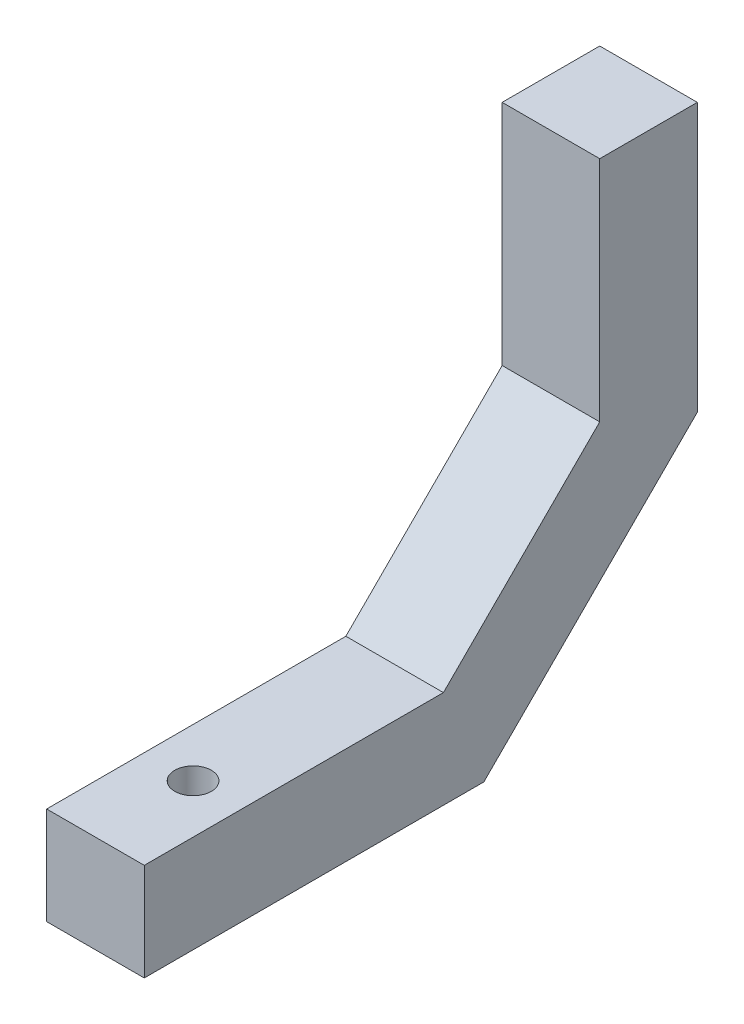
from build123d import *

# Parameters (mm, degrees)
BOSS_EXTRUDE1_DEPTH      = 4
BOSS_EXTRUDE1_DEPTH_BACK = 4
SKETCH3_R                = 1.5
CUT_EXTRUDE1_DEPTH       = 56.353099281


with BuildPart() as part:
    # Sketch1 → Boss-Extrude1 (new, two sides: drawn at the far end of the back side and taken through both)
    with BuildSketch(Plane(origin=(0, 0, 0), x_dir=(0, 0, -1), z_dir=(1, 0, 0)).offset(-BOSS_EXTRUDE1_DEPTH_BACK)):
        Polygon((-8, 4), (0, 4), (0, -18), (-17.5, -35.5), (-37.34, -35.5), (-45.34, -35.5), (-45.34, -27.5), (-37.34, -27.5), (-20.813708499, -27.5), (-8, -14.686291501), align=None)
    extrude(amount=BOSS_EXTRUDE1_DEPTH + BOSS_EXTRUDE1_DEPTH_BACK)

    # Sketch3 → Cut-Extrude1 (cut, through all)
    with BuildSketch(Plane(origin=(0, -27.5, 0), x_dir=(1, 0, 0), z_dir=(0, 1, 0))):
        with Locations((0, -37.34)):
            Circle(SKETCH3_R)
    extrude(amount=-CUT_EXTRUDE1_DEPTH, mode=Mode.SUBTRACT)


solid = part.part
